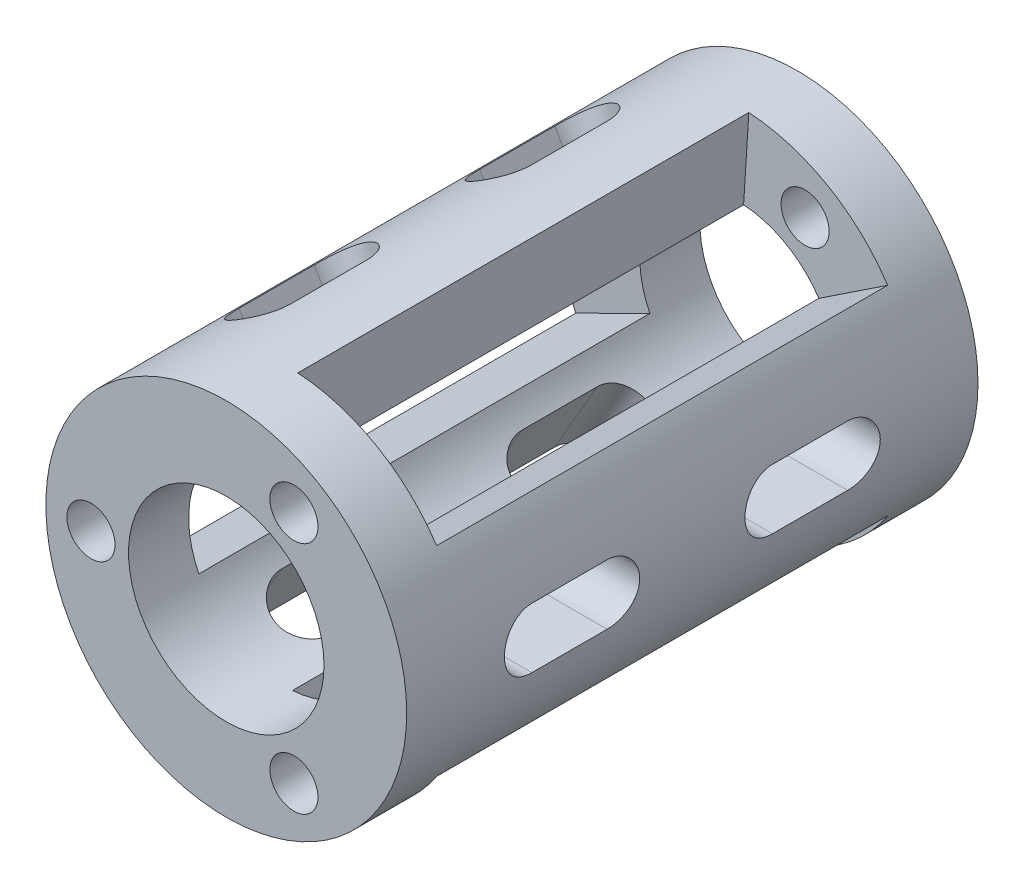
from build123d import *
from build123d.topology import SkipClean

# Parameters (mm, degrees)
CROQUIS1_R              = 12
CROQUIS1_R_2            = 6.5
CROQUIS1_R_3            = 1.6
SALIENTE_EXTRUIR1_DEPTH = 4
SALIENTE_EXTRUIR2_DEPTH = 30
CROQUIS3_R              = 12
CROQUIS3_R_2            = 6.5
CROQUIS3_R_3            = 1.6
SALIENTE_EXTRUIR3_DEPTH = 4
CORTAR_EXTRUIR2_DEPTH   = 50
MATRIZC1_COUNT          = 3


with BuildPart() as part:
    # Croquis1 → Saliente-Extruir1 (new body)
    with BuildSketch(Plane(origin=(0, 0, 0), x_dir=(0, 1, 0), z_dir=(0, 0, 1))):
        Circle(CROQUIS1_R)
        Circle(CROQUIS1_R_2, mode=Mode.SUBTRACT)
        with Locations((0, 9)):
            Circle(CROQUIS1_R_3, mode=Mode.SUBTRACT)
        with Locations((7.794228634, -4.5)):
            Circle(CROQUIS1_R_3, mode=Mode.SUBTRACT)
        with Locations((-7.794228634, -4.5)):
            Circle(CROQUIS1_R_3, mode=Mode.SUBTRACT)
    extrude(amount=SALIENTE_EXTRUIR1_DEPTH)

    # Croquis2 → Saliente-Extruir2 (add)
    with SkipClean():  # the faces are left unmerged after this step: merging them gives an invalid solid
        with BuildSketch(Plane.XY.offset(4)):
            with BuildLine():
                Line((-5.822741707, -2.888888889), (-10.749676998, -5.333333333))
                ThreePointArc((-10.749676998, -5.333333333), (-6, -10.392304845), (0.756036345, -11.976160029))
                Line((0.756036345, -11.976160029), (0.409519687, -6.487086682))
                ThreePointArc((0.409519687, -6.487086682), (-3.25, -5.629165125), (-5.822741707, -2.888888889))
            make_face()
            with BuildLine():
                ThreePointArc((0.756036345, 11.976160029), (-6, 10.392304845), (-10.749676998, 5.333333333))
                Line((-10.749676998, 5.333333333), (-5.822741707, 2.888888889))
                ThreePointArc((-5.822741707, 2.888888889), (-3.25, 5.629165125), (0.409519687, 6.487086682))
                Line((0.409519687, 6.487086682), (0.756036345, 11.976160029))
            make_face()
            with BuildLine():
                Line((5.41322202, -3.598197794), (9.993640652, -6.642826696))
                ThreePointArc((9.993640652, -6.642826696), (12, 0), (9.993640652, 6.642826696))
                Line((9.993640652, 6.642826696), (5.41322202, 3.598197794))
                ThreePointArc((5.41322202, 3.598197794), (6.5, 0), (5.41322202, -3.598197794))
            make_face()
        extrude(amount=SALIENTE_EXTRUIR2_DEPTH)

    # Croquis3 → Saliente-Extruir3 (add)
    with SkipClean():  # the faces are left unmerged after this step: merging them gives an invalid solid
        with BuildSketch(Plane.XY.offset(34)):
            Circle(CROQUIS3_R)
            Circle(CROQUIS3_R_2, mode=Mode.SUBTRACT)
            with Locations((-9, 0)):
                Circle(CROQUIS3_R_3, mode=Mode.SUBTRACT)
            with Locations((4.5, 7.794228634)):
                Circle(CROQUIS3_R_3, mode=Mode.SUBTRACT)
            with Locations((4.5, -7.794228634)):
                Circle(CROQUIS3_R_3, mode=Mode.SUBTRACT)
        extrude(amount=SALIENTE_EXTRUIR3_DEPTH)

    # Croquis7 → Cortar-Extruir2 (cut, symmetric)
    with SkipClean():  # the faces are left unmerged after this step: merging them gives an invalid solid
        with BuildSketch(Plane.YZ):
            with BuildLine():
                Line((-2, 24.5), (-2, 29.5))
                ThreePointArc((-2, 29.5), (0, 31.5), (2, 29.5))
                Line((2, 29.5), (2, 24.5))
                ThreePointArc((2, 24.5), (0, 22.5), (-2, 24.5))
            make_face()
            with BuildLine():
                Line((-2, 13.5), (-2, 8.5))
                ThreePointArc((-2, 8.5), (0, 6.5), (2, 8.5))
                Line((2, 8.5), (2, 13.5))
                ThreePointArc((2, 13.5), (0, 15.5), (-2, 13.5))
            make_face()
        cortar_extruir2 = extrude(amount=CORTAR_EXTRUIR2_DEPTH, both=True, mode=Mode.SUBTRACT)

    # MatrizC1: Cortar-Extruir2 ×3 about axis
    with SkipClean():  # the faces are left unmerged after this step: merging them gives an invalid solid
        matrizc1_axis = Axis((0, 0, 4), (0, 0, -1))
        for i in range(1, MATRIZC1_COUNT):
            add(cortar_extruir2.rotate(matrizc1_axis, i * 360 / MATRIZC1_COUNT), mode=Mode.SUBTRACT)


solid = part.part
